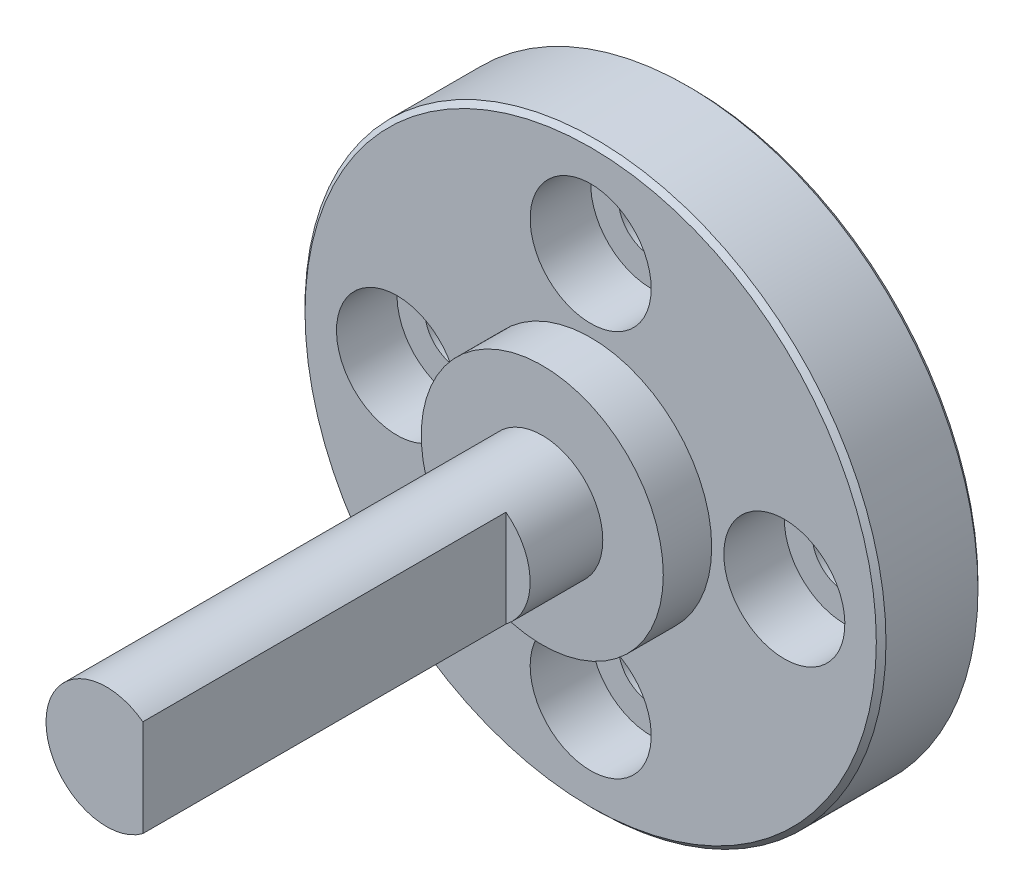
from build123d import *

# Parameters (mm, degrees)
SKETCH_1_R                     = 12
EXTRUDE_1_DEPTH                = 4.2
SKETCH_2_R                     = 5
EXTRUDE_2_DEPTH                = 2
HOLE_WIZARD_M2_5_1_D           = 2.7
HOLE_WIZARD_M2_5_1_CBORE_D     = 5
HOLE_WIZARD_M2_5_1_CBORE_DEPTH = 2.5
PATTERN_CIRCULAR_1_COUNT       = 4
CHAMFER_3_SIZE                 = 0.2
SKETCH_12_R                    = 2.5
EXTRUDE_1650_DEPTH             = 20
CUT_EXTRUDE_START              = -15
CUT_EXTRUDE_1_DEPTH            = 15


with BuildPart() as part:
    # 草图1 → 凸台-拉伸1 (new body)
    with BuildSketch(Plane.XY):
        Circle(SKETCH_1_R)
    extrude(amount=EXTRUDE_1_DEPTH)

    # 草图2 → 凸台-拉伸2 (add)
    with BuildSketch(Plane.XY.offset(4.2)):
        Circle(SKETCH_2_R)
    extrude(amount=EXTRUDE_2_DEPTH)

    # M2.5 六角圆柱头螺钉的柱形沉头孔1 (through all)
    with Locations(Plane.XY.offset(4.2)):
        with Locations((0, 8)):
            hole_wizard_m2_5_1 = CounterBoreHole(HOLE_WIZARD_M2_5_1_D / 2, HOLE_WIZARD_M2_5_1_CBORE_D / 2, HOLE_WIZARD_M2_5_1_CBORE_DEPTH)

    # 阵列(圆周)1: M2.5 六角圆柱头螺钉的柱形沉头孔1 ×4 about axis
    pattern_circular_1_axis = Axis((0, 0, 4.2), (0, 0, -1))
    for i in range(1, PATTERN_CIRCULAR_1_COUNT):
        add(hole_wizard_m2_5_1.rotate(pattern_circular_1_axis, i * 360 / PATTERN_CIRCULAR_1_COUNT), mode=Mode.SUBTRACT)

    # 倒角3
    chamfer_3_edges = [part.edges().sort_by_distance(p)[0] for p in [
        (-12, 0, 0),
        (-12, 0, 4.2),
    ]]
    chamfer(chamfer_3_edges, length=CHAMFER_3_SIZE)

    # 草图12 → Extrude 1650 (add)
    with BuildSketch(Plane.XY.offset(4.2)):
        Circle(SKETCH_12_R)
    extrude(amount=EXTRUDE_1650_DEPTH)

    # 草图13 → 切除-拉伸1 (cut)
    with BuildSketch(Plane.XY.offset(24.2).offset(CUT_EXTRUDE_START)):
        with BuildLine():
            Line((1.5, 2), (1.5, -2))
            ThreePointArc((1.5, -2), (2.5, 0), (1.5, 2))
        make_face()
    extrude(amount=CUT_EXTRUDE_1_DEPTH, mode=Mode.SUBTRACT)


solid = part.part
